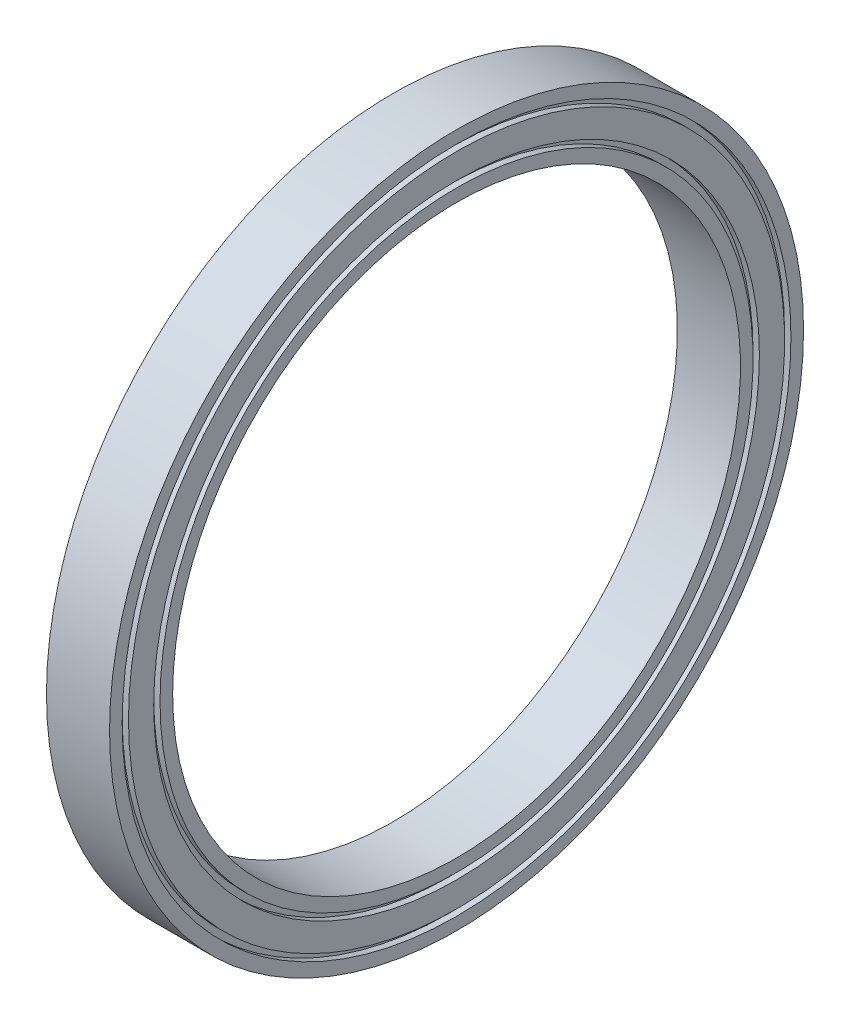
from build123d import *


with BuildPart() as part:
    # Sketch1 → Revolve1 (revolve)
    with BuildSketch(Plane.XY):
        Polygon((-2.5, 27.5), (2.5, 27.5), (2.5, 26.5), (2, 26.5), (2, 26), (2.5, 26), (2.5, 24), (2, 24), (2, 23.5), (2.5, 23.5), (2.5, 22.5), (-2.5, 22.5), (-2.5, 23.5), (-2, 23.5), (-2, 24), (-2.5, 24), (-2.5, 26), (-2, 26), (-2, 26.5), (-2.5, 26.5), align=None)
    revolve(axis=Axis((0, 0, 0), (1, 0, 0)))


solid = part.part
